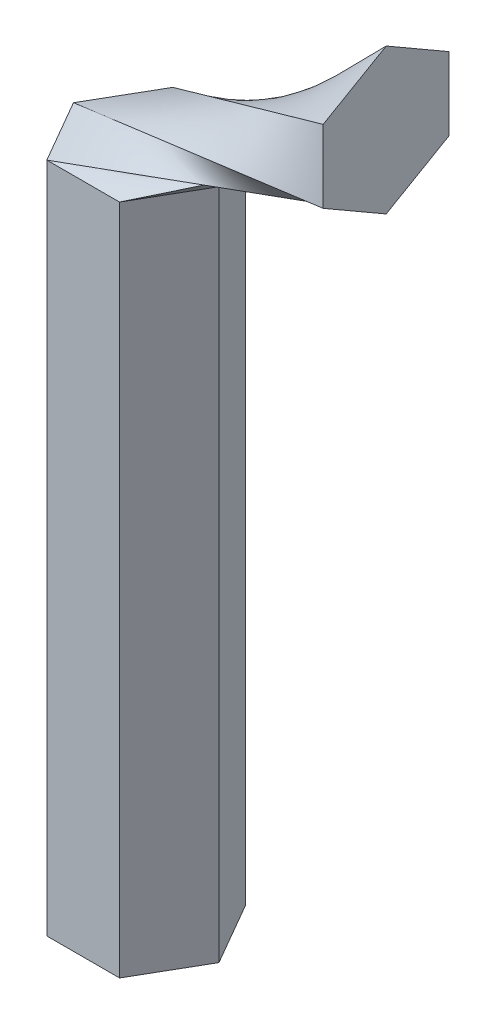
from build123d import *

# Parameters (mm, degrees)
BOSS_EXTRUDE1_DEPTH = 35.56


with BuildPart() as part:
    # Sketch1 → Boss-Extrude1 (new, symmetric)
    with BuildSketch(Plane(origin=(0, 0, 0), x_dir=(1, 0, 0), z_dir=(0, 1, 0))):
        Polygon((7.69896584, 0), (3.84948292, 6.6675), (-3.84948292, 6.6675), (-7.69896584, 0), (-3.84948292, -6.6675), (3.84948292, -6.6675), align=None)
    extrude(amount=BOSS_EXTRUDE1_DEPTH, both=True)

    # Loft2: read off the stored shape, not the designer's step
    # Loft2: loft between two sections, ruled curve by curve
    loft2_from = [
        Edge.make_bspline([(25.4, 45.75948292, 6.6675), (25.4, 47.042643893, 6.6675), (25.4, 48.325804866, 6.6675), (25.4, 50.892126813, 6.6675), (25.4, 52.175287786, 6.6675), (25.4, 53.458448759, 6.6675)], [0, 0, 0, 0, 0.5, 0.5, 1, 1, 1, 1], 3),
        Edge.make_bspline([(25.4, 53.458448759, 6.6675), (25.4, 54.100029246, 5.55625), (25.4, 54.741609733, 4.445), (25.4, 56.024770706, 2.2225), (25.4, 56.666351193, 1.11125), (25.4, 57.307931679, 0)], [0, 0, 0, 0, 0.5, 0.5, 1, 1, 1, 1], 3),
        Edge.make_bspline([(25.4, 41.91, 0), (25.4, 42.551580487, 1.11125), (25.4, 43.193160973, 2.2225), (25.4, 44.476321947, 4.445), (25.4, 45.117902433, 5.55625), (25.4, 45.75948292, 6.6675)], [0, 0, 0, 0, 0.5, 0.5, 1, 1, 1, 1], 3),
        Edge.make_bspline([(25.4, 57.307931679, 0), (25.4, 56.666351193, -1.11125), (25.4, 56.024770706, -2.2225), (25.4, 54.741609733, -4.445), (25.4, 54.100029246, -5.55625), (25.4, 53.458448759, -6.6675)], [0, 0, 0, 0, 0.5, 0.5, 1, 1, 1, 1], 3),
        Edge.make_bspline([(25.4, 53.458448759, -6.6675), (25.4, 52.175287786, -6.6675), (25.4, 50.892126813, -6.6675), (25.4, 48.325804866, -6.6675), (25.4, 47.042643893, -6.6675), (25.4, 45.75948292, -6.6675)], [0, 0, 0, 0, 0.5, 0.5, 1, 1, 1, 1], 3),
        Edge.make_bspline([(25.4, 45.75948292, -6.6675), (25.4, 45.117902433, -5.55625), (25.4, 44.476321947, -4.445), (25.4, 43.193160973, -2.2225), (25.4, 42.551580487, -1.11125), (25.4, 41.91, 0)], [0, 0, 0, 0, 0.5, 0.5, 1, 1, 1, 1], 3),
    ]
    loft2_to = [
        Edge.make_bspline([(-7.69896584, 35.56, 0), (-7.057385353, 35.56, -1.11125), (-6.415804866, 35.56, -2.2225), (-5.132643893, 35.56, -4.445), (-4.491063406, 35.56, -5.55625), (-3.84948292, 35.56, -6.6675)], [0, 0, 0, 0, 0.5, 0.5, 1, 1, 1, 1], 3),
        Edge.make_bspline([(-3.84948292, 35.56, -6.6675), (-2.566321947, 35.56, -6.6675), (-1.283160973, 35.56, -6.6675), (1.283160973, 35.56, -6.6675), (2.566321947, 35.56, -6.6675), (3.84948292, 35.56, -6.6675)], [0, 0, 0, 0, 0.5, 0.5, 1, 1, 1, 1], 3),
        Edge.make_bspline([(-3.84948292, 35.56, 6.6675), (-4.491063406, 35.56, 5.55625), (-5.132643893, 35.56, 4.445), (-6.415804866, 35.56, 2.2225), (-7.057385353, 35.56, 1.11125), (-7.69896584, 35.56, 0)], [0, 0, 0, 0, 0.5, 0.5, 1, 1, 1, 1], 3),
        Edge.make_bspline([(3.84948292, 35.56, -6.6675), (4.491063406, 35.56, -5.55625), (5.132643893, 35.56, -4.445), (6.415804866, 35.56, -2.2225), (7.057385353, 35.56, -1.11125), (7.69896584, 35.56, 0)], [0, 0, 0, 0, 0.5, 0.5, 1, 1, 1, 1], 3),
        Edge.make_bspline([(7.69896584, 35.56, 0), (7.057385353, 35.56, 1.11125), (6.415804866, 35.56, 2.2225), (5.132643893, 35.56, 4.445), (4.491063406, 35.56, 5.55625), (3.84948292, 35.56, 6.6675)], [0, 0, 0, 0, 0.5, 0.5, 1, 1, 1, 1], 3),
        Edge.make_bspline([(3.84948292, 35.56, 6.6675), (2.566321947, 35.56, 6.6675), (1.283160973, 35.56, 6.6675), (-1.283160973, 35.56, 6.6675), (-2.566321947, 35.56, 6.6675), (-3.84948292, 35.56, 6.6675)], [0, 0, 0, 0, 0.5, 0.5, 1, 1, 1, 1], 3),
    ]
    loft2 = Solid(Shell([*[Face.make_surface_from_curves(loft2_from[k], loft2_to[k]) for k in range(6)], Face(Wire(loft2_from)), Face(Wire(loft2_to))]))
    add(loft2)


solid = part.part
